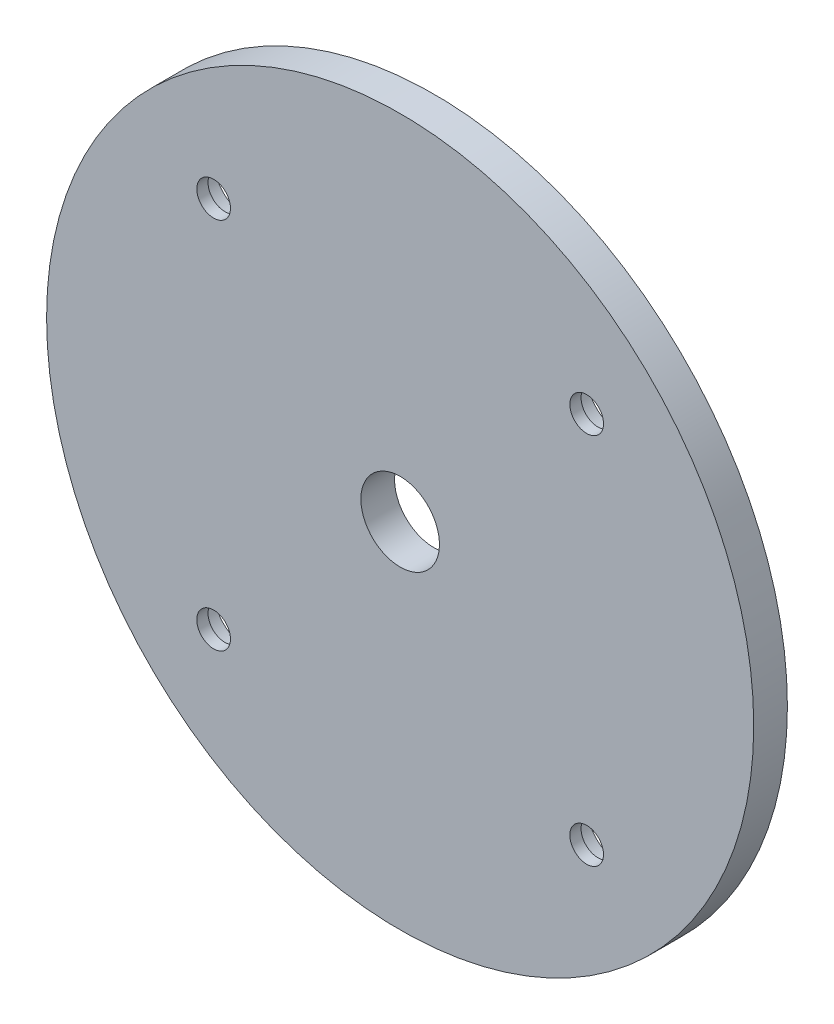
from build123d import *

# Parameters (mm, degrees)
CROQUIS1_R              = 31.5
CROQUIS1_R_2            = 1.5
SALIENTE_EXTRUIR1_DEPTH = 3
CROQUIS4_R              = 3.5
CORTAR_EXTRUIR3_DEPTH   = 3
CORTAR_EXTRUIR6_DEPTH   = 1
CROQUIS9_R              = 3
CORTAR_EXTRUIR7_DEPTH   = 2


with BuildPart() as part:
    # Croquis1 → Saliente-Extruir1 (new body)
    with BuildSketch(Plane.XY):
        with Locations((-43.449193048, 8.207110309)):
            Circle(CROQUIS1_R)
        with Locations((-60.066202406, 24.824119667)):
            Circle(CROQUIS1_R_2, mode=Mode.SUBTRACT)
        with Locations((-26.83218369, 24.824119667)):
            Circle(CROQUIS1_R_2, mode=Mode.SUBTRACT)
        with Locations((-26.83218369, -8.409899049)):
            Circle(CROQUIS1_R_2, mode=Mode.SUBTRACT)
        with Locations((-60.066202406, -8.409899049)):
            Circle(CROQUIS1_R_2, mode=Mode.SUBTRACT)
    extrude(amount=SALIENTE_EXTRUIR1_DEPTH)

    # Croquis4 → Cortar-Extruir3 (cut)
    with BuildSketch(Plane(origin=(0, 0, 0), x_dir=(-1, 0, 0), z_dir=(0, 0, -1))):
        with Locations((43.449193048, 8.207110309)):
            Circle(CROQUIS4_R)
    extrude(amount=-CORTAR_EXTRUIR3_DEPTH, mode=Mode.SUBTRACT)

    # Croquis8 → Cortar-Extruir6 (cut)
    with BuildSketch(Plane(origin=(0, 0, 0), x_dir=(-1, 0, 0), z_dir=(0, 0, -1))):
        with BuildLine():
            Line((14.449193048, 9.207110309), (17.449193048, 9.207110309))
            ThreePointArc((17.449193048, 9.207110309), (43.449193048, 35.207110309), (69.449193048, 9.207110309))
            Line((69.449193048, 9.207110309), (72.449193048, 9.207110309))
            ThreePointArc((72.449193048, 9.207110309), (43.449193048, 38.207110309), (14.449193048, 9.207110309))
        make_face()
        with BuildLine():
            Line((14.449193048, 7.207110309), (17.449193048, 7.207110309))
            ThreePointArc((17.449193048, 7.207110309), (43.449193048, -18.792889691), (69.449193048, 7.207110309))
            Line((69.449193048, 7.207110309), (72.449193048, 7.207110309))
            ThreePointArc((72.449193048, 7.207110309), (43.449193048, -21.792889691), (14.449193048, 7.207110309))
        make_face()
    extrude(amount=-CORTAR_EXTRUIR6_DEPTH, mode=Mode.SUBTRACT)

    # Croquis9 → Cortar-Extruir7 (cut)
    with BuildSketch(Plane(origin=(0, 0, 0), x_dir=(-1, 0, 0), z_dir=(0, 0, -1))):
        with Locations((26.83218369, 24.824119667)):
            Circle(CROQUIS9_R)
        with Locations((60.066202406, 24.824119667)):
            Circle(CROQUIS9_R)
        with Locations((26.83218369, -8.409899049)):
            Circle(CROQUIS9_R)
        with Locations((60.066202406, -8.409899049)):
            Circle(CROQUIS9_R)
    extrude(amount=-CORTAR_EXTRUIR7_DEPTH, mode=Mode.SUBTRACT)


solid = part.part
